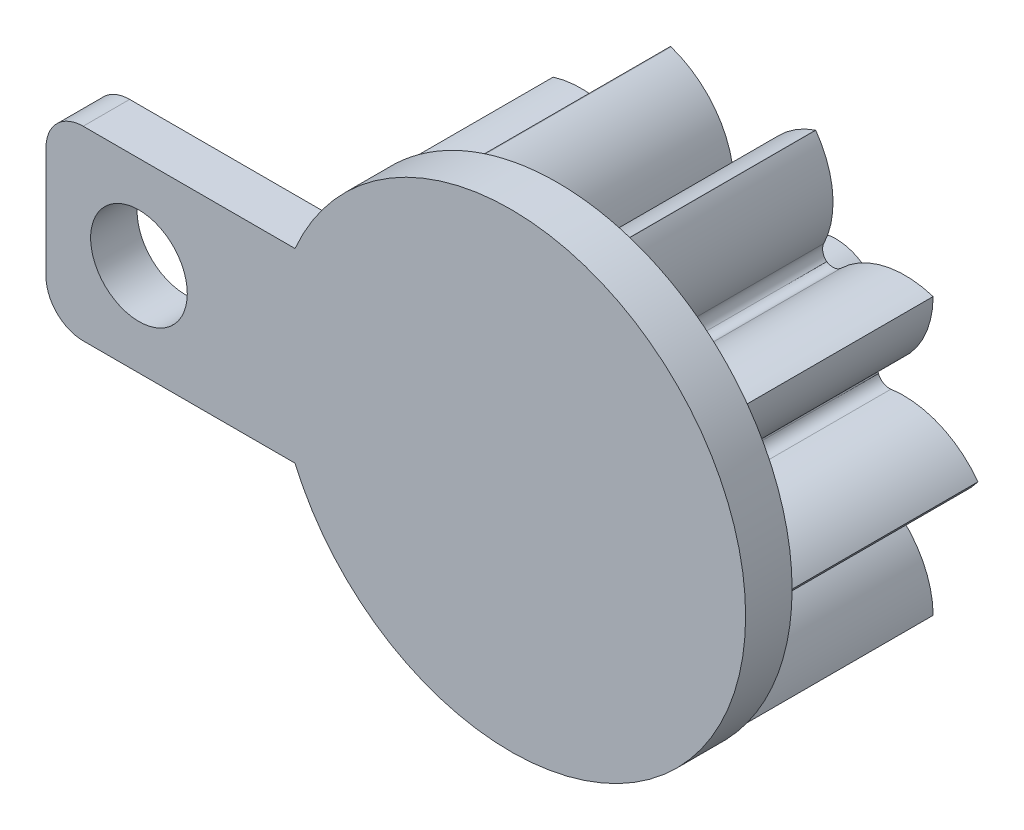
from build123d import *

# Parameters (mm, degrees)
SKETCH1_R           = 16.192287761
BOSS_EXTRUDE1_DEPTH = 12.7
CUT_EXTRUDE1_DEPTH  = 12.7
FILLET1_R           = 0.809614388
CIRPATTERN1_DEPTH   = 12.7
SKETCH3_R           = 3.175
BOSS_EXTRUDE2_DEPTH = 6.35
SKETCH5_R           = 3.302
BOSS_EXTRUDE3_DEPTH = 3.175


# Read off the part's stored shape, not the designer's step: CirPattern1
with BuildPart() as part:
    # Sketch1 → Boss-Extrude1 (new body)
    with BuildSketch(Plane.XY):
        Circle(SKETCH1_R)
    extrude(amount=BOSS_EXTRUDE1_DEPTH)

    # Sketch2 → Cut-Extrude1 (cut)
    with BuildSketch(Plane.XY.offset(12.7)):
        with BuildLine():
            ThreePointArc((-0.648981162, 9.693672643), (-2.761211409, 13.995350311), (-7.286822608, 15.571672188))
            ThreePointArc((-7.286822608, 15.571672188), (0, 17.192287761), (7.286822608, 15.571672188))
            ThreePointArc((7.286822608, 15.571672188), (2.761211409, 13.995350311), (0.648981162, 9.693672643))
            ThreePointArc((0.648981162, 9.693672643), (0, 9.715372656), (-0.648981162, 9.693672643))
        make_face()
    extrude(amount=-CUT_EXTRUDE1_DEPTH, mode=Mode.SUBTRACT)

    # Fillet1
    # the kernel refuses this fillet: 0.809614388 mm, written as the material it adds along each edge
    with BuildSketch(Plane(origin=(0.648981162, 9.693672643, 12.7), x_dir=(0.12156320456415769, 0.9925836928421162, 0), z_dir=(0, 0, -1))) as fillet1_piece_1:
        with BuildLine():
            CenterArc((0.738327126, -0.808389468), FILLET1_R, 93.152151787, 79.518968538)
            ThreePointArc((-0.064672931, -0.705111371), (-0.025910634, -0.353145064), (0, 0))
            ThreePointArc((0, 0), (0.346904155, -0.009544948), (0.69380831, 0))
        make_face()
    extrude(amount=12.7)
    with BuildSketch(Plane(origin=(-0.648981162, 9.693672643, 12.7), x_dir=(0.9995379445948291, 0.030395679218338256, 0), z_dir=(0, 0, -1))) as fillet1_piece_2:
        with BuildLine():
            CenterArc((0.737574027, -0.809076654), FILLET1_R, 92.088363944, 79.518968538)
            ThreePointArc((-0.063370217, -0.690908233), (-0.022180058, -0.346325921), (0, 0))
            ThreePointArc((0, 0), (0.354035533, -0.006452804), (0.708071066, 0))
        make_face()
    extrude(amount=12.7)
    # the kernel refuses this fillet: 0.809614388 mm, written as the material it takes off along each edge
    with BuildSketch(Plane(origin=(-5.198948894, 15.334963753, 13.415202102), x_dir=(-0.9443027648777296, -0.32907793642885796, 0), z_dir=(0, 0, -1))) as fillet1_2_piece_1:
        with BuildLine():
            CenterArc((0.267182003, -0.809585402), FILLET1_R, 89.515166978, 38.350588161)
            ThreePointArc((-0.229770211, -0.170434439), (-0.115851307, -0.08391464), (0, 0))
            ThreePointArc((0, 0), (0.137016412, 0.000579715), (0.274032824, 0))
        make_face()
    extrude(amount=14.130404205, mode=Mode.SUBTRACT)
    with BuildSketch(Plane(origin=(5.198948894, 15.334963753, 13.415202102), x_dir=(0.9443027648777299, -0.32907793642885697, 0), z_dir=(0, 0, -1))) as fillet1_2_piece_2:
        with BuildLine():
            CenterArc((0.267182003, 0.809585402), FILLET1_R, 232.134244861, 38.350588161)
            ThreePointArc((-0.229770211, 0.170434439), (-0.115851307, 0.08391464), (0, 0))
            ThreePointArc((0, 0), (0.137016412, -0.000579715), (0.274032824, 0))
        make_face()
    extrude(amount=14.130404205, mode=Mode.SUBTRACT)

    # CirPattern1 outline → CirPattern1 (cut)
    with BuildSketch(Plane.XY):
        with BuildLine():
            ThreePointArc((4.958837242, 15.259978898), (6.118325298, 12.120958043), (5.50931312, 8.830522108))
            ThreePointArc((5.50931312, 8.830522108), (5.445351284, 8.311585796), (5.711912975, 7.86177375))
            ThreePointArc((5.711912975, 7.86177375), (6.222081746, 7.747258083), (6.695854212, 7.968449544))
            ThreePointArc((6.695854212, 7.968449544), (9.637377118, 9.564531404), (12.981378188, 9.431523325))
            ThreePointArc((12.981378188, 9.431523325), (12.074523228, 6.21008756), (9.647578607, 3.905749452))
            ThreePointArc((9.647578607, 3.905749452), (9.290809283, 3.523516981), (9.242069335, 3.002930361))
            ThreePointArc((9.242069335, 3.002930361), (9.58749392, 2.610415561), (10.100796975, 2.510886743))
            ThreePointArc((10.100796975, 2.510886743), (13.418692374, 2.073160309), (16.045865882, 0))
            ThreePointArc((16.045865882, 0), (13.418692374, -2.073160309), (10.100796975, -2.510886743))
            ThreePointArc((10.100796975, -2.510886743), (9.58749392, -2.610415561), (9.242069335, -3.002930361))
            ThreePointArc((9.242069335, -3.002930361), (9.290809283, -3.523516981), (9.647578607, -3.905749452))
            ThreePointArc((9.647578607, -3.905749452), (12.074523228, -6.21008756), (12.981378188, -9.431523325))
            ThreePointArc((12.981378188, -9.431523325), (9.637377118, -9.564531404), (6.695854212, -7.968449544))
            ThreePointArc((6.695854212, -7.968449544), (6.222081746, -7.747258083), (5.711912975, -7.86177375))
            ThreePointArc((5.711912975, -7.86177375), (5.445351284, -8.311585796), (5.50931312, -8.830522108))
            ThreePointArc((5.50931312, -8.830522108), (6.118296607, -12.121293054), (4.958445247, -15.260525306))
            ThreePointArc((4.958445247, -15.260525306), (2.174911365, -13.402576589), (0.733322724, -10.382335457))
            ThreePointArc((0.733322724, -10.382335457), (0.480045825, -9.924911338), (0, -9.717686779))
            ThreePointArc((0, -9.717686779), (-0.480045825, -9.924911338), (-0.733322724, -10.382335457))
            ThreePointArc((-0.733322724, -10.382335457), (-2.174911365, -13.402576589), (-4.958445247, -15.260525306))
            ThreePointArc((-4.958445247, -15.260525306), (-6.118296607, -12.121293054), (-5.50931312, -8.830522108))
            ThreePointArc((-5.50931312, -8.830522108), (-5.445351284, -8.311585796), (-5.711912975, -7.86177375))
            ThreePointArc((-5.711912975, -7.86177375), (-6.222081746, -7.747258083), (-6.695854212, -7.968449544))
            ThreePointArc((-6.695854212, -7.968449544), (-9.637377118, -9.564531404), (-12.981378188, -9.431523325))
            ThreePointArc((-12.981378188, -9.431523325), (-12.074523228, -6.21008756), (-9.647578607, -3.905749452))
            ThreePointArc((-9.647578607, -3.905749452), (-9.290809283, -3.523516981), (-9.242069335, -3.002930361))
            ThreePointArc((-9.242069335, -3.002930361), (-9.58749392, -2.610415561), (-10.100796975, -2.510886743))
            ThreePointArc((-10.100796975, -2.510886743), (-13.418692374, -2.073160309), (-16.045865882, 0))
            ThreePointArc((-16.045865882, 0), (-13.418692374, 2.073160309), (-10.100796975, 2.510886743))
            ThreePointArc((-10.100796975, 2.510886743), (-9.58749392, 2.610415561), (-9.242069335, 3.002930361))
            ThreePointArc((-9.242069335, 3.002930361), (-9.290809283, 3.523516981), (-9.647578607, 3.905749452))
            ThreePointArc((-9.647578607, 3.905749452), (-12.074523228, 6.21008756), (-12.981378188, 9.431523325))
            ThreePointArc((-12.981378188, 9.431523325), (-9.637377118, 9.564531404), (-6.695854212, 7.968449544))
            ThreePointArc((-6.695854212, 7.968449544), (-6.222081746, 7.747258083), (-5.711912975, 7.86177375))
            ThreePointArc((-5.711912975, 7.86177375), (-5.445351284, 8.311585796), (-5.50931312, 8.830522108))
            ThreePointArc((-5.50931312, 8.830522108), (-6.118325298, 12.120958043), (-4.958837242, 15.259978898))
            ThreePointArc((-4.958837242, 15.259978898), (-5.20947806, 15.291785512), (-5.457718847, 15.244785597))
            ThreePointArc((-5.457718847, 15.244785597), (0, -16.192287761), (5.457718847, 15.244785597))
            ThreePointArc((5.457718847, 15.244785597), (5.20947806, 15.291785512), (4.958837242, 15.259978898))
        make_face()
    extrude(amount=CIRPATTERN1_DEPTH, mode=Mode.SUBTRACT)

    # Sketch3 → Boss-Extrude2 (add)
    with BuildSketch(Plane(origin=(0, 0, 0), x_dir=(-1, 0, 0), z_dir=(0, 0, -1))):
        with Locations(Location((0, 0, 0), (0, 0, 180))):
            Circle(SKETCH3_R)
    extrude(amount=BOSS_EXTRUDE2_DEPTH)

    # Sketch5 → Boss-Extrude3 (add)
    with BuildSketch(Plane.XY.offset(12.7)):
        with BuildLine():
            Line((-14.735919106, 6.35), (-29.21, 6.35))
            ThreePointArc((-29.21, 6.35), (-31.006051224, 5.606051224), (-31.75, 3.81))
            Line((-31.75, 3.81), (-31.75, -3.81))
            ThreePointArc((-31.75, -3.81), (-31.006051224, -5.606051224), (-29.21, -6.35))
            Line((-29.21, -6.35), (-14.735919106, -6.35))
            ThreePointArc((-14.735919106, -6.35), (16.045865882, 0), (-14.735919106, 6.35))
        make_face()
        with Locations((-25.4, 0)):
            Circle(SKETCH5_R, mode=Mode.SUBTRACT)
    extrude(amount=BOSS_EXTRUDE3_DEPTH)


solid = part.part
